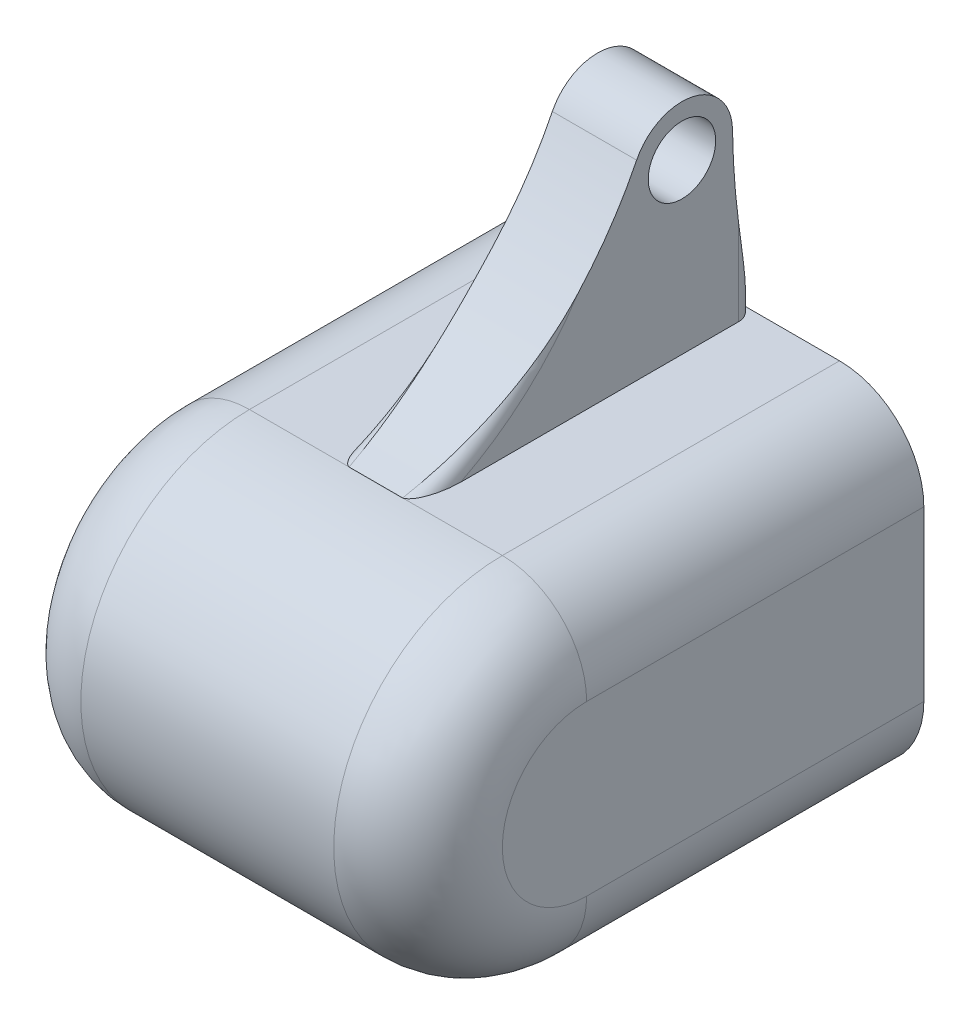
from build123d import *

# Parameters (mm, degrees)
SALIENTE_EXTRUIR1_DEPTH = 25
REDONDEO1_R             = 5
VACIADO1_T              = -2
SALIENTE_EXTRUIR2_DEPTH = 2.5
REDONDEO3_R             = 1
CROQUIS4_R              = 2
CORTAR_EXTRUIR1_DEPTH   = 43.193943257
CORTAR_EXTRUIR2_DEPTH   = 10


with BuildPart() as part:
    # Croquis1 → Saliente-Extruir1 (new body)
    with BuildSketch(Plane(origin=(0, 0, 0), x_dir=(0, 0, -1), z_dir=(1, 0, 0))):
        with BuildLine():
            Line((0, 0), (20, 0))
            Line((20, 0), (20, 20))
            Line((20, 20), (0, 20))
            ThreePointArc((0, 20), (-10, 10), (0, 0))
        make_face()
    extrude(amount=SALIENTE_EXTRUIR1_DEPTH)

    # Redondeo1
    redondeo1_edges = [part.edges().sort_by_distance(p)[0] for p in [
        (0, 0, -10),
        (0, 10, 10),
        (25, 0, -10),
        (25, 10, 10),
        (0, 20, -10),
        (25, 20, -10),
    ]]
    fillet(redondeo1_edges, radius=REDONDEO1_R)

    # Vaciado1
    vaciado1_openings = [part.faces().sort_by_distance(p)[0] for p in [
        (12.5, 10, -20),
    ]]
    offset(amount=VACIADO1_T, openings=vaciado1_openings, kind=Kind.INTERSECTION)


with BuildPart() as saliente_extruir2_tool:
    # Croquis3 → Saliente-Extruir2 (new, symmetric)
    with BuildSketch(Plane(origin=(12.5, 0, 0), x_dir=(0, 0, -1), z_dir=(1, 0, 0))):
        with BuildLine():
            Line((20, 20), (20, 33.990128519))
            Line((20, 33.990128519), (11.304943529, 33.990128519))
            ThreePointArc((11.304943529, 33.990128519), (7.637753489, 25.384236828), (-0.012060129, 20))
            Line((-0.012060129, 20), (20, 20))
        make_face()
    extrude(amount=SALIENTE_EXTRUIR2_DEPTH, both=True)


with BuildPart() as part_1:
    add(part.part)


with BuildPart() as part_2:
    # Saliente-Extruir2: joined with saliente_extruir2_tool
    add(part_1.part.fuse(saliente_extruir2_tool.part, tol=0.00001))

    # Redondeo3
    redondeo3_edges = [part_2.edges().sort_by_distance(p)[0] for p in [
        (15, 33.990128519, -15.652471765),
        (15, 26.99506426, -20),
        (15, 25.384236828, -7.637753489),
        (10, 26.99506426, -20),
        (10, 25.384236828, -7.637753489),
        (10, 33.990128519, -15.652471765),
    ]]
    fillet(redondeo3_edges, radius=REDONDEO3_R)

    # Croquis4 → Cortar-Extruir1 (cut, through all)
    with BuildSketch(Plane(origin=(15, 0, 0), x_dir=(0, 0, -1), z_dir=(1, 0, 0))):
        with Locations((15.652471765, 29.990128519)):
            Circle(CROQUIS4_R)
    extrude(amount=-CORTAR_EXTRUIR1_DEPTH, mode=Mode.SUBTRACT)

    # Croquis5 → Cortar-Extruir2 (cut)
    with BuildSketch(Plane(origin=(15, 0, 0), x_dir=(0, 0, -1), z_dir=(1, 0, 0))):
        with BuildLine():
            Line((-7.217046024, 20), (0, 20))
            ThreePointArc((0, 20), (7.606790839, 24.37534101), (12.965556832, 31.324477852))
            ThreePointArc((12.965556832, 31.324477852), (16.316683617, 32.915675069), (18.652159682, 30.033399776))
            ThreePointArc((18.652159682, 30.033399776), (19.02695235, 24.97651649), (20, 20))
            Line((20, 20), (25.571513897, 20))
            Line((25.571513897, 20), (25.571513897, 39.781584786))
            Line((25.571513897, 39.781584786), (-7.217046024, 39.781584786))
            Line((-7.217046024, 39.781584786), (-7.217046024, 20))
        make_face()
    extrude(amount=-CORTAR_EXTRUIR2_DEPTH, mode=Mode.SUBTRACT)


solid = part_2.part
